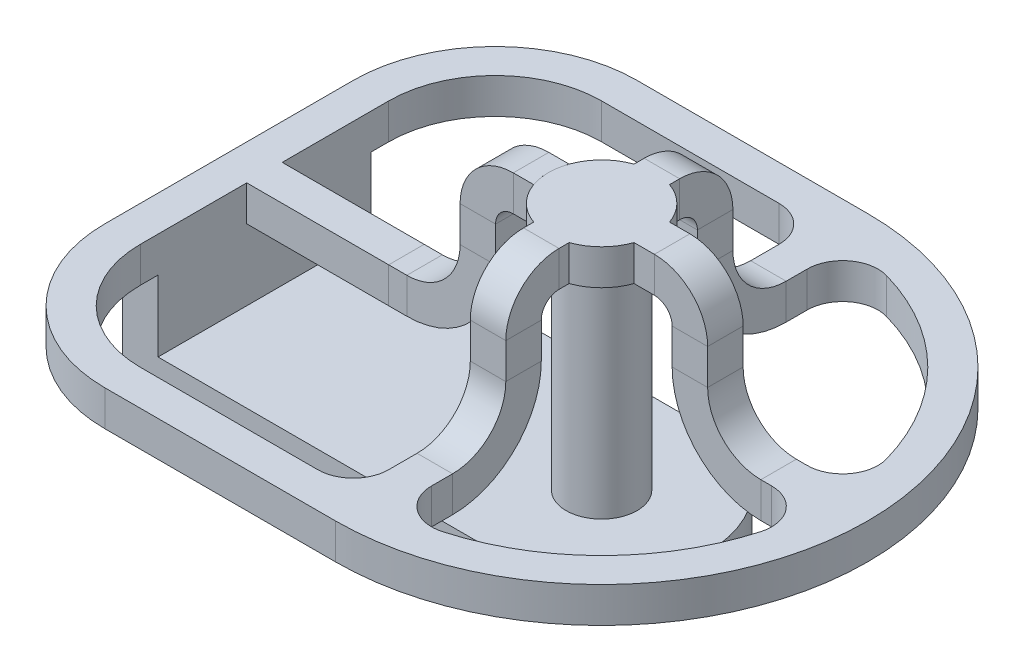
from build123d import *

# Parameters (mm, degrees)
BOSS_EXTRUDE1_DEPTH = 30
BOSS_EXTRUDE2_DEPTH = 10
SKETCH4_R           = 10
BOSS_EXTRUDE3_DEPTH = 60
SKETCH5_R           = 15
BOSS_EXTRUDE4_DEPTH = 10
BOSS_EXTRUDE5_DEPTH = 10
SWEEP4_START        = 55
SWEEP4_OUTLINE_W    = 10
SWEEP4_OUTLINE_H    = 10
SWEEP4_DEPTH        = 10
SWEEP4_START_2      = 30
SWEEP4_2_DEPTH      = 25
SWEEP4_START_3      = 65
SWEEP4_3_DEPTH      = 15
SWEEP4_START_4      = -5
SWEEP4_4_DEPTH      = 10
SWEEP6_START        = 100
SWEEP6_DEPTH        = 10
BOSS_EXTRUDE6_REACH = 195.972
SKETCH12_W          = 10
SKETCH12_H          = 10
FILLET1_R           = 30
FILLET2_R           = 40
FILLET3_R           = 10


with BuildPart() as part:
    # Sketch2 → Boss-Extrude1 (new, symmetric)
    with BuildSketch(Plane.XY):
        Polygon((0, 10), (0, 0), (10, 0), (105, 0), (105, 10), (10, 10), (10, 30), (0, 30), align=None)
    extrude(amount=BOSS_EXTRUDE1_DEPTH, both=True)

    # Sketch3 → Boss-Extrude2 (add)
    with BuildSketch(Plane(origin=(0, 10, 0), x_dir=(1, 0, 0), z_dir=(0, 1, 0))):
        with BuildLine():
            Line((105, 30), (105, -30))
            ThreePointArc((105, -30), (135, 0), (105, 30))
        make_face()
    extrude(amount=-BOSS_EXTRUDE2_DEPTH)

    # Sketch4 → Boss-Extrude3 (add)
    with BuildSketch(Plane(origin=(0, 10, 0), x_dir=(1, 0, 0), z_dir=(0, 1, 0))):
        with Locations(Location((105, 0, 0), (0, 0, 270))):
            Circle(SKETCH4_R)
    extrude(amount=BOSS_EXTRUDE3_DEPTH)

    # Sketch5 → Boss-Extrude4 (add)
    with BuildSketch(Plane(origin=(0, 70, 0), x_dir=(1, 0, 0), z_dir=(0, 1, 0))):
        with Locations(Location((105, 0, 0), (0, 0, 270))):
            Circle(SKETCH5_R)
    extrude(amount=BOSS_EXTRUDE4_DEPTH)

    # Sketch6 → Boss-Extrude5 (add)
    with BuildSketch(Plane(origin=(0, 30, 0), x_dir=(1, 0, 0), z_dir=(0, 1, 0))):
        with BuildLine():
            Line((0, 75), (0, 0))
            Line((0, 0), (0, -75))
            Line((0, -75), (105, -75))
            ThreePointArc((105, -75), (158.033008589, -53.033008589), (180, 0))
            ThreePointArc((180, 0), (158.033008589, 53.033008589), (105, 75))
            Line((105, 75), (0, 75))
        make_face()
        with BuildLine():
            Line((10, -65), (10, -5))
            Line((10, -5), (50, -5))
            Line((50, -5), (50, 5))
            Line((50, 5), (10, 5))
            Line((10, 5), (10, 65))
            Line((10, 65), (100, 65))
            Line((100, 65), (100, 50))
            Line((100, 50), (110, 50))
            Line((110, 50), (110, 64.807406984))
            ThreePointArc((110, 64.807406984), (152.696960071, 44.158804332), (170, 0))
            ThreePointArc((170, 0), (152.696960071, -44.158804332), (110, -64.807406984))
            Line((110, -64.807406984), (110, -50))
            Line((110, -50), (100, -50))
            Line((100, -50), (100, -65))
            Line((100, -65), (10, -65))
        make_face(mode=Mode.SUBTRACT)
    extrude(amount=BOSS_EXTRUDE5_DEPTH)

    # Sweep6: read off the stored shape, not the designer's step
    # Sweep6 outline → Sweep6 (add)
    with BuildSketch(Plane.YZ.offset(SWEEP6_START)):
        with BuildLine():
            Line((70, 17), (70, 13))
            Line((70, 13), (80, 13))
            Line((80, 13), (80, 17))
            ThreePointArc((80, 17), (75.606601718, 27.606601718), (65, 32))
            Line((65, 32), (55, 32))
            ThreePointArc((55, 32), (44.393398282, 36.393398282), (40, 47))
            Line((40, 47), (40, 50))
            Line((40, 50), (30, 50))
            Line((30, 50), (30, 47))
            ThreePointArc((30, 47), (37.32233047, 29.32233047), (55, 22))
            Line((55, 22), (65, 22))
            ThreePointArc((65, 22), (68.535533906, 20.535533906), (70, 17))
        make_face()
    sweep6 = extrude(amount=SWEEP6_DEPTH)

    # Mirror1: Sweep6 across plane
    add(sweep6.mirror(Plane.XY))

    # Sketch12 → Boss-Extrude6 (add, up to next)
    with BuildSketch(Plane(origin=(160, 0, 0), x_dir=(0, 0, -1), z_dir=(1, 0, 0)), mode=Mode.PRIVATE) as boss_extrude6_sk1:
        with Locations((0, 35)):
            Rectangle(SKETCH12_W, SKETCH12_H)
    boss_extrude6_tool1 = extrude(boss_extrude6_sk1.sketch, amount=BOSS_EXTRUDE6_REACH, mode=Mode.PRIVATE) - part.part


with BuildPart() as body_2:
    # Sweep4: read off the stored shape, not the designer's step
    # Sweep4 outline → Sweep4 (new body)
    with BuildSketch(Plane(origin=(0, 0, 0), x_dir=(1, 0, 0), z_dir=(0, 1, 0)).offset(SWEEP4_START)):
        with Locations((75.121266537, 0)):
            Rectangle(SWEEP4_OUTLINE_W, SWEEP4_OUTLINE_H)
    extrude(amount=SWEEP4_DEPTH)

    # Sweep4 2 outline → Sweep4 2 (add)
    with BuildSketch(Plane(origin=(0, 0, 0), x_dir=(1, 0, 0), z_dir=(0, 1, 0)).offset(SWEEP4_START_2)):
        with BuildLine():
            Line((50, -5), (90.857864376, -5))
            ThreePointArc((90.857864376, -5), (90, 0), (90.857864376, 5))
            Line((90.857864376, 5), (50, 5))
            Line((50, 5), (50, -5))
        make_face()
    extrude(amount=SWEEP4_2_DEPTH)

    # Sweep4 3 outline → Sweep4 3 (add)
    with BuildSketch(Plane(origin=(0, 0, 0), x_dir=(1, 0, 0), z_dir=(0, 1, 0)).offset(SWEEP4_START_3)):
        with BuildLine():
            Line((50, -5), (90.857864376, -5))
            ThreePointArc((90.857864376, -5), (90, 0), (90.857864376, 5))
            Line((90.857864376, 5), (50, 5))
            Line((50, 5), (50, -5))
        make_face()
    extrude(amount=SWEEP4_3_DEPTH)

    # Sweep4 4 outline → Sweep4 4 (cut)
    with BuildSketch(Plane.XY.offset(SWEEP4_START_4)):
        with BuildLine():
            ThreePointArc((70.121266537, 65), (74.514664819, 75.606601718), (85.121266537, 80))
            Line((85.121266537, 80), (50, 80))
            Line((50, 80), (50, 65))
            Line((50, 65), (70.121266537, 65))
        make_face()
        with BuildLine():
            Line((50, 40), (55.121266537, 40))
            ThreePointArc((55.121266537, 40), (65.727868255, 44.393398282), (70.121266537, 55))
            Line((70.121266537, 55), (50, 55))
            Line((50, 55), (50, 40))
        make_face()
        with BuildLine():
            ThreePointArc((80.121266537, 55), (72.798936067, 37.32233047), (55.121266537, 30))
            Line((55.121266537, 30), (92, 30))
            Line((92, 30), (92, 55))
            Line((92, 55), (80.121266537, 55))
        make_face()
        with BuildLine():
            Line((92, 65), (92, 70))
            Line((92, 70), (85.121266537, 70))
            ThreePointArc((85.121266537, 70), (81.585732631, 68.535533906), (80.121266537, 65))
            Line((80.121266537, 65), (92, 65))
        make_face()
    extrude(amount=SWEEP4_4_DEPTH, mode=Mode.SUBTRACT)


with BuildPart() as body_3:
    # Mirror4: mirrored copy
    add(body_2.part.mirror(Plane(origin=(105, 0, 0), x_dir=(0, 0, 1), z_dir=(1, 0, 0))))


with BuildPart() as part_1:
    add(part.part)

    add(body_3.part)  # Boss-Extrude6 merges body 3
    add(boss_extrude6_tool1.solids().sort_by_distance((160, 35, 0))[0])

    # Fillet1
    fillet1_edges = [part_1.edges().sort_by_distance(p)[0] for p in [
        (10, 35, 65),
        (10, 35, -65),
    ]]
    fillet(fillet1_edges, radius=FILLET1_R)

    # Fillet2
    fillet2_edges = [part_1.edges().sort_by_distance(p)[0] for p in [
        (0, 35, -75),
        (0, 35, 75),
    ]]
    fillet(fillet2_edges, radius=FILLET2_R)

    # Fillet3
    fillet3_edges = [part_1.edges().sort_by_distance(p)[0] for p in [
        (169.807406984, 35, 5),
        (169.807406984, 35, -5),
        (110, 35, -64.807406984),
        (110, 35, 64.807406984),
        (100, 35, 65),
        (100, 35, -65),
    ]]
    fillet(fillet3_edges, radius=FILLET3_R)


solid = Compound([body_2.part, part_1.part])
